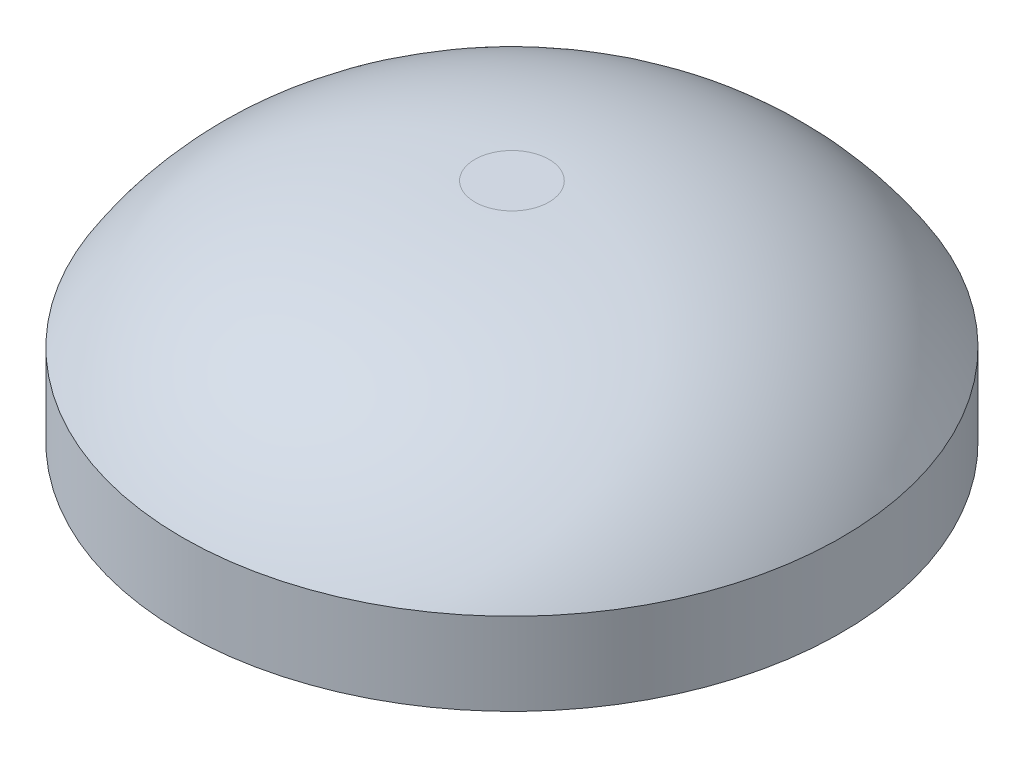
from build123d import *


with BuildPart() as part:
    # Esquisse1 → Révolution1 (revolve)
    with BuildSketch(Plane.XY):
        with BuildLine():
            Line((0, 2.75), (0, 0))
            Line((0, 0), (4, 0))
            Line((4, 0), (4, 1))
            add(Edge.make_bspline(
                [(0.449555654, 2.75), (2.945294106, 2.67934827), (4, 1)],
                knots=[0.075570808, 0.075570808, 0.075570808, 0.93592127, 0.93592127, 0.93592127], degree=2))
            Line((0.449555654, 2.75), (0, 2.75))
        make_face()
    revolve(axis=Axis((0, 2.75, 0), (0, -1, 0)))


solid = part.part
